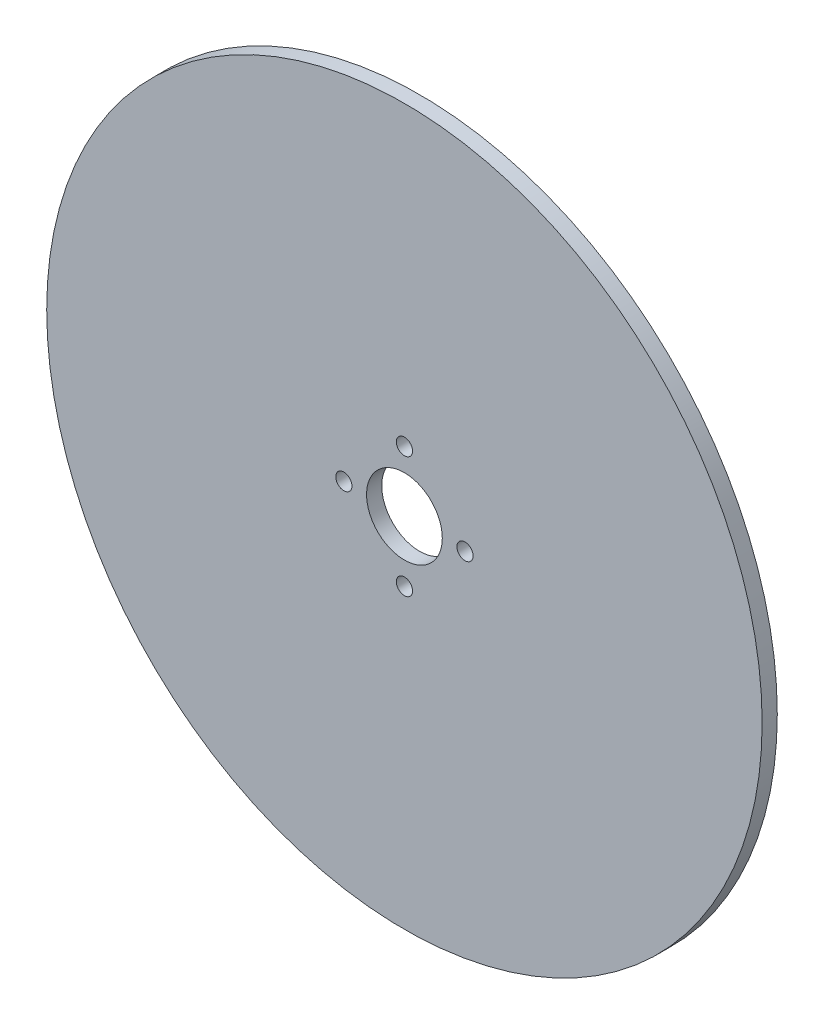
from build123d import *

# Parameters (mm, degrees)
SKETCH1_R                = 75
SKETCH1_R_2              = 7.9375
BOSS_EXTRUDE1_DEPTH      = 3.175
M3_CLEARANCE_HOLE1_D     = 3.4
M3_CLEARANCE_HOLE1_DEPTH = 4
M3_CLEARANCE_HOLE1_TIP   = 1.021463052


with BuildPart() as part:
    # Sketch1 → Boss-Extrude1 (new body)
    with BuildSketch(Plane.XY):
        Circle(SKETCH1_R)
        Circle(SKETCH1_R_2, mode=Mode.SUBTRACT)
    extrude(amount=BOSS_EXTRUDE1_DEPTH)

    # M3 Clearance Hole1
    with Locations(Plane.XY.offset(3.175)):
        with Locations((0, 12.7), (0, -12.7), (12.7, 0), (-12.7, 0)):
            Hole(M3_CLEARANCE_HOLE1_D / 2, depth=M3_CLEARANCE_HOLE1_DEPTH)
            with Locations((0, 0, -(M3_CLEARANCE_HOLE1_DEPTH + M3_CLEARANCE_HOLE1_TIP / 2))):  # 118° drill point
                Cone(0, M3_CLEARANCE_HOLE1_D / 2, M3_CLEARANCE_HOLE1_TIP, mode=Mode.SUBTRACT)


solid = part.part
